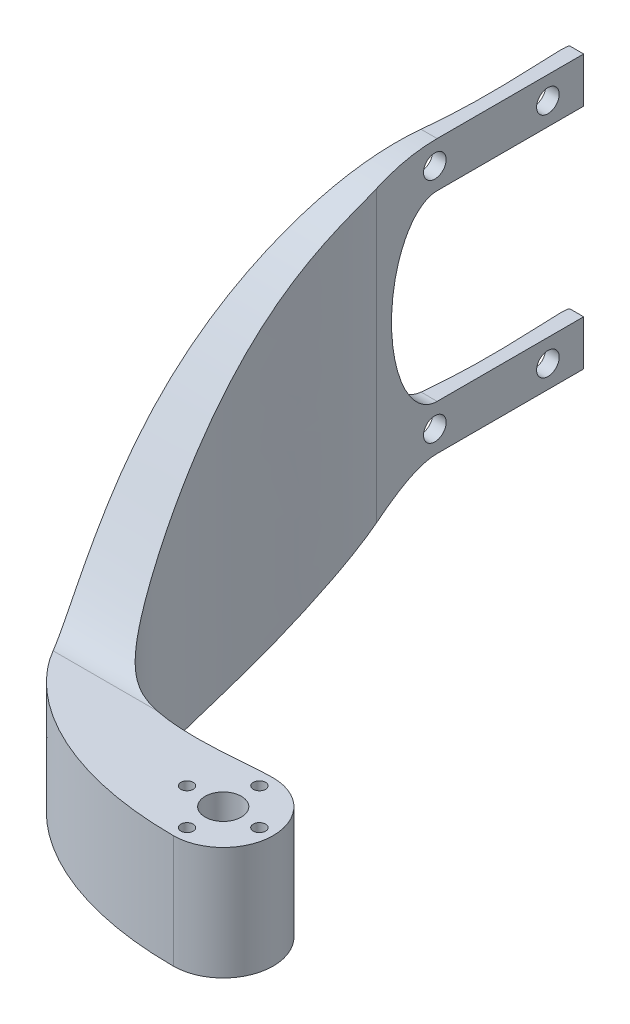
from build123d import *

# Parameters (mm, degrees)
BOSS_EXTRUDE1_START = -78.5
BOSS_EXTRUDE1_DEPTH = 157
SKETCH5_W           = 473.004377806
SKETCH5_H           = 558.860634618
CUT_EXTRUDE1_DEPTH  = 109.5
SKETCH6_R           = 1.36
SKETCH6_R_2         = 4
CUT_EXTRUDE2_DEPTH  = 25
SKETCH7_R           = 2.5
CUT_EXTRUDE3_DEPTH  = 10
SKETCH8_R           = 4.25
CUT_EXTRUDE4_DEPTH  = 2


# Read off the part's stored shape, not the designer's step: Boss-Extrude1
with BuildPart() as part:
    # Boss-Extrude1 outline → Boss-Extrude1 (new body)
    with BuildSketch(Plane.XZ.offset(BOSS_EXTRUDE1_START)):
        with BuildLine():
            ThreePointArc((0, -11.05), (11.05, 0), (0, 11.05))
            add(Edge.make_bspline(
                [(0, 11.05), (-73.705988569, 11.05), (-70.075162013, -66.476999877), (-19.953361107, -14.552256493), (-38.925778701, -112.613618432), (-35.925778701, -112.613618432)],
                knots=[0, 0, 0, 0, 0, 0, 1, 1, 1, 1, 1, 1], degree=5))
            Line((-35.925778701, -112.613618432), (-32.925778701, -112.613618432))
            Line((-32.925778701, -112.613618432), (-32.925778701, -66.813618432))
            add(Edge.make_bspline(
                [(-32.925778701, -66.813618432), (-32.925778701, -47.05), (-63.009039822, 1.033261121), (-14.925778701, -11.05), (0, -11.05)],
                knots=[0, 0, 0, 0, 0, 1, 1, 1, 1, 1], degree=4))
        make_face()
    extrude(amount=BOSS_EXTRUDE1_DEPTH)

    # Sketch5 → Cut-Extrude1 (cut, symmetric)
    with BuildSketch(Plane.ZY):
        with Locations((-57.495001252, 3.891745074)):
            Rectangle(SKETCH5_W, SKETCH5_H)
        with BuildLine():
            Line((-117.55, 11.0465), (-80.216666667, 11.0465))
            add(Edge.make_bspline(
                [(-11.05, -25), (-46.05, -25), (-65.216666667, 11.0465), (-80.216666667, 11.0465)],
                knots=[0, 0, 0, 0, 1, 1, 1, 1], degree=3))
            Line((-11.05, -25), (11.05, -25))
            Line((11.05, -25), (11.05, 0))
            Line((11.05, 0), (-11.05, 0))
            add(Edge.make_bspline(
                [(-11.05, 0), (-26.05, 0), (-40.216666667, 71.3715), (-80.216666667, 71.3715)],
                knots=[0, 0, 0, 0, 1, 1, 1, 1], degree=3))
            Line((-80.216666667, 71.3715), (-117.55, 71.3715))
            Line((-117.55, 71.3715), (-117.55, 61.3715))
            Line((-117.55, 61.3715), (-80.216666667, 61.3715))
            add(Edge.make_bspline(
                [(-80.216666667, 21.0465), (-70.133333333, 21.0465), (-70.133333333, 41.209), (-70.133333333, 61.3715), (-80.216666667, 61.3715)],
                knots=[3.141592654, 3.141592654, 3.141592654, 4.71238898, 4.71238898, 6.283185307, 6.283185307, 6.283185307], degree=2, weights=[1, 0.707106781, 1, 0.707106781, 1]))
            Line((-80.216666667, 21.0465), (-117.55, 21.0465))
            Line((-117.55, 21.0465), (-117.55, 11.0465))
        make_face(mode=Mode.SUBTRACT)
    extrude(amount=CUT_EXTRUDE1_DEPTH, both=True, mode=Mode.SUBTRACT)

    # Sketch6 → Cut-Extrude2 (cut)
    with BuildSketch(Plane.XZ.offset(25)):
        with Locations(Location((0, 8, 0), (0, 0, 270))):
            Circle(SKETCH6_R)
        with Locations(Location((0, 0, 0), (0, 0, 270))):
            Circle(SKETCH6_R_2)
        with Locations(Location((8, 0, 0), (0, 0, 270))):
            Circle(SKETCH6_R)
        with Locations(Location((-8, 0, 0), (0, 0, 270))):
            Circle(SKETCH6_R)
        with Locations(Location((0, -8, 0), (0, 0, 270))):
            Circle(SKETCH6_R)
    extrude(amount=-CUT_EXTRUDE2_DEPTH, mode=Mode.SUBTRACT)

    # Sketch7 → Cut-Extrude3 (cut)
    with BuildSketch(Plane(origin=(-32.925778701, 0, 0), x_dir=(0, 0, -1), z_dir=(1, 0, 0))):
        with Locations((79.713618432, 66.3715)):
            Circle(SKETCH7_R)
        with Locations((104.713618432, 66.3715)):
            Circle(SKETCH7_R)
        with Locations((104.713618432, 16.0465)):
            Circle(SKETCH7_R)
        with Locations((79.713618432, 16.0465)):
            Circle(SKETCH7_R)
    extrude(amount=-CUT_EXTRUDE3_DEPTH, mode=Mode.SUBTRACT)

    # Sketch8 → Cut-Extrude4 (cut)
    with BuildSketch(Plane(origin=(-37.925778701, 0, 0), x_dir=(0, 0, -1), z_dir=(1, 0, 0))):
        with Locations(Location((79.713618432, 66.3715, 0), (0, 0, 180))):
            Circle(SKETCH8_R)
        with Locations((104.713618432, 66.3715)):
            Circle(SKETCH8_R)
        with Locations((104.713618432, 16.0465)):
            Circle(SKETCH8_R)
        with Locations(Location((79.713618432, 16.0465, 0), (0, 0, 180))):
            Circle(SKETCH8_R)
    extrude(amount=CUT_EXTRUDE4_DEPTH, mode=Mode.SUBTRACT)


solid = part.part
